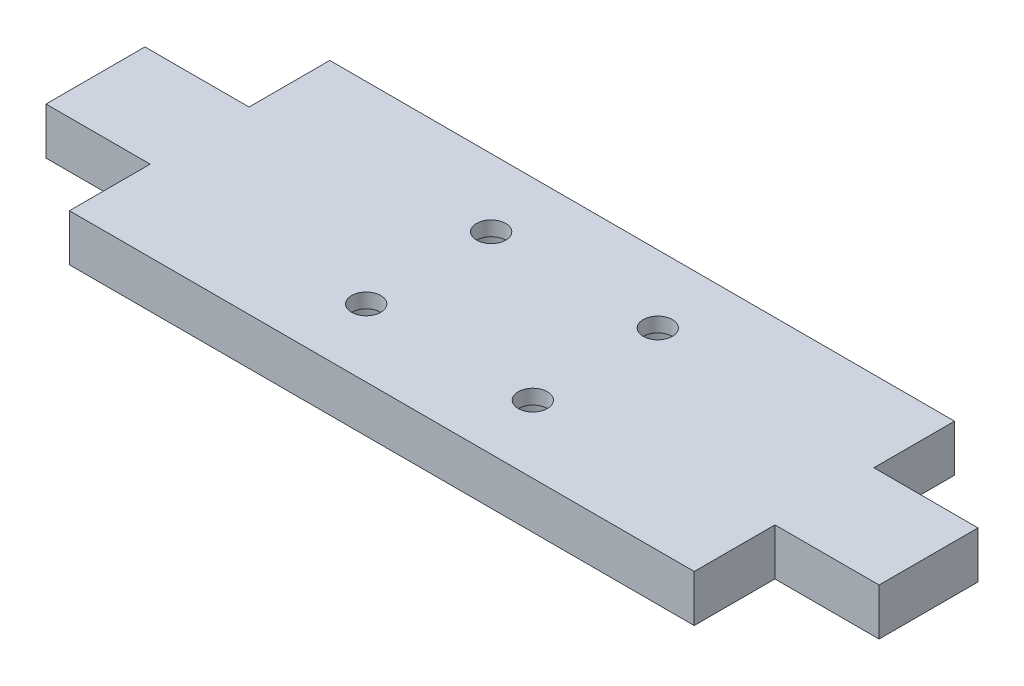
from build123d import *

# Parameters (mm, degrees)
SKETCH1_W                       = 25
SKETCH1_H                       = 4.5
BOSS_EXTRUDE1_DEPTH             = 30
SKETCH2_W                       = 9.5
SKETCH2_H                       = 4.5
BOSS_EXTRUDE2_DEPTH             = 10
CBORE_FOR_M3_SBHCS2_D           = 2.8
CBORE_FOR_M3_SBHCS2_CBORE_D     = 5.5
CBORE_FOR_M3_SBHCS2_CBORE_DEPTH = 3.1


with BuildPart() as part:
    # Sketch1 → Boss-Extrude1 (new, symmetric)
    with BuildSketch(Plane(origin=(0, 0, 0), x_dir=(0, 0, -1), z_dir=(1, 0, 0))):
        Rectangle(SKETCH1_W, SKETCH1_H)
    extrude(amount=BOSS_EXTRUDE1_DEPTH, both=True)

    # Sketch2 → Boss-Extrude2 (add)
    with BuildSketch(Plane(origin=(30, 0, 0), x_dir=(0, 0, -1), z_dir=(1, 0, 0))):
        Rectangle(SKETCH2_W, SKETCH2_H)
    boss_extrude2 = extrude(amount=BOSS_EXTRUDE2_DEPTH)

    # Mirror1: Boss-Extrude2 across plane
    add(boss_extrude2.mirror(Plane(origin=(0, 0, 0), x_dir=(0, 0, 1), z_dir=(1, 0, 0))))

    # CBORE for M3 SBHCS2 (through all)
    with Locations(Plane(origin=(0, -2.25, 0), x_dir=(-1, 0, 0), z_dir=(0, -1, 0))):
        with Locations((-8, 6), (8, 6), (8, -6), (-8, -6)):
            CounterBoreHole(CBORE_FOR_M3_SBHCS2_D / 2, CBORE_FOR_M3_SBHCS2_CBORE_D / 2, CBORE_FOR_M3_SBHCS2_CBORE_DEPTH)


solid = part.part
